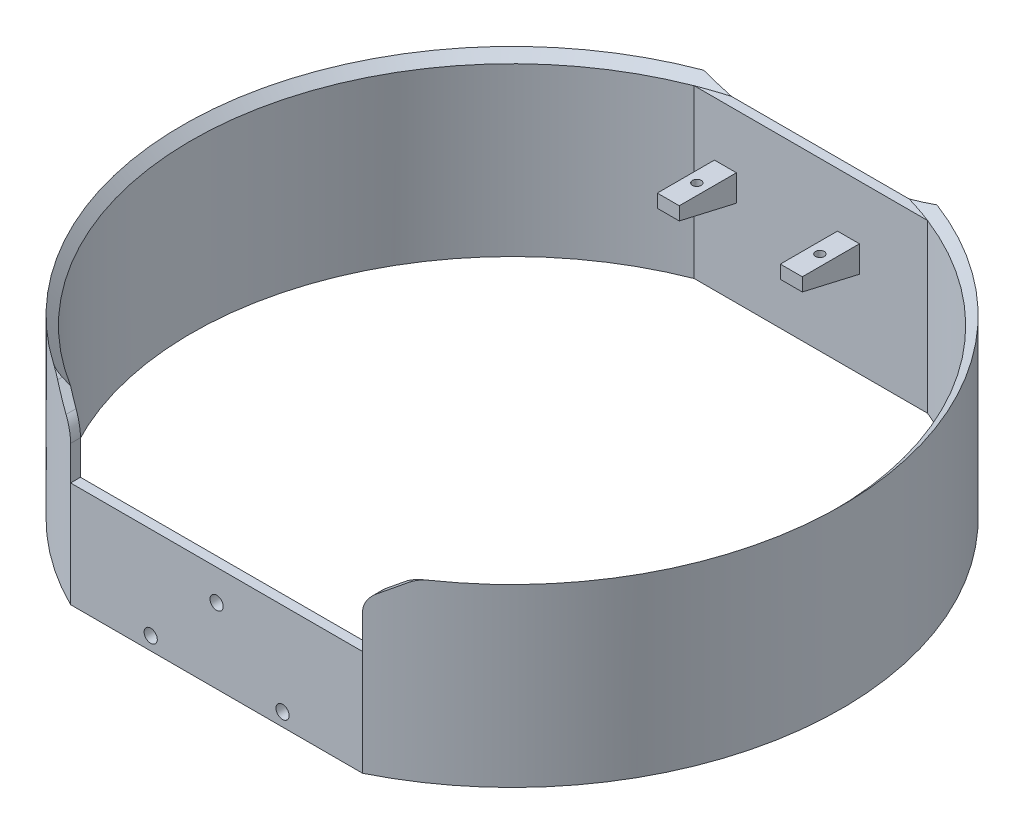
from build123d import *
from OCP.BRepFilletAPI import BRepFilletAPI_MakeChamfer

# Parameters (mm, degrees)
BOSS_EXTRUDE10_DEPTH             = 38
CUT_EXTRUDE7_DEPTH               = 114.357840488
CUT_EXTRUDE7_DEPTH_BACK          = 114.357840488
CUT_EXTRUDE8_REACH               = 164.861
SKETCH44_W                       = 5
SKETCH44_H                       = 3
BOSS_EXTRUDE11_DEPTH             = 13
CHAMFER11_SIZE                   = 3
CHAMFER11_SIZE_2                 = 13
F_2_0_START                      = 25.919230669
F_2_0_2_DIAMETER_HOLE1_OUTLINE_R = 1
F_2_0_2_DIAMETER_HOLE1_DEPTH     = 4.730769331
M4_CLEARANCE_HOLE1_D             = 4.5
F_6_0_6_DIAMETER_HOLE1_D         = 6
FILLET33_R                       = 1
F_3_0_3_DIAMETER_HOLE2_D         = 3
F_3_0_3_DIAMETER_HOLE2_DEPTH     = 2.238381896
SKETCH53_R                       = 75
CUT_EXTRUDE9_DEPTH               = 111.204355799


# Read off the part's stored shape, not the designer's step: Ø2.0 (2) Diameter Hole1
with BuildPart() as part:
    # Sketch34 → Revolve1 (revolve)
    with BuildSketch(Plane.XY, mode=Mode.PRIVATE) as revolve1_sk:
        Polygon((5, 0), (75, 0), (75, 45), (73, 43), (73, 5), (5, 5), align=None)
    revolve(revolve1_sk.sketch.rotate(Axis((0, 0, 0), (0, 1, 0)), 90), axis=Axis((0, 0, 0), (0, 1, 0)))

    # Sketch35 → Boss-Extrude10 (add)
    with BuildSketch(Plane(origin=(0, 5, 0), x_dir=(1, 0, 0), z_dir=(0, 1, 0))):
        with BuildLine():
            Line((-26.551836095, 68), (26.551836095, 68))
            ThreePointArc((26.551836095, 68), (0, 73), (-26.551836095, 68))
        make_face()
        with BuildLine():
            Line((33.226495452, -65), (-33.226495452, -65))
            ThreePointArc((-33.226495452, -65), (0, -73), (33.226495452, -65))
        make_face()
    extrude(amount=BOSS_EXTRUDE10_DEPTH)

    # Sketch36 → Cut-Extrude7 (cut, two sides: drawn at the far end of the back side and taken through both)
    with BuildSketch(Plane(origin=(0, 5, 0), x_dir=(1, 0, 0), z_dir=(0, 1, 0)).offset(-CUT_EXTRUDE7_DEPTH_BACK)):
        with BuildLine():
            Line((-26.551836095, 70.142711667), (26.551836095, 70.142711667))
            ThreePointArc((26.551836095, 70.142711667), (0, 75), (-26.551836095, 70.142711667))
        make_face()
        with BuildLine():
            Line((-33.226495452, -67.238381896), (33.226495452, -67.238381896))
            ThreePointArc((33.226495452, -67.238381896), (0, -75), (-33.226495452, -67.238381896))
        make_face()
    extrude(amount=CUT_EXTRUDE7_DEPTH + CUT_EXTRUDE7_DEPTH_BACK, mode=Mode.SUBTRACT)

    # Sketch43 → Cut-Extrude8 (cut, up to next)
    with BuildSketch(Plane.XY.offset(67.238381896), mode=Mode.PRIVATE) as cut_extrude8_sk1:
        with BuildLine():
            Line((-33.226495452, 29), (33.226495452, 29))
            Line((33.226495452, 29), (33.226495452, 36.795504442))
            ThreePointArc((33.226495452, 36.795504442), (33.791441286, 39.104247508), (35.35861327, 40.891264663))
            Line((35.35861327, 40.891264663), (39.935107214, 44.095760221))
            ThreePointArc((39.935107214, 44.095760221), (41.299460399, 44.768584754), (42.802989396, 45))
            Line((42.802989396, 45), (-42.802989396, 45))
            ThreePointArc((-42.802989396, 45), (-41.299460399, 44.768584754), (-39.935107214, 44.095760221))
            Line((-39.935107214, 44.095760221), (-35.35861327, 40.891264663))
            ThreePointArc((-35.35861327, 40.891264663), (-33.791441286, 39.104247508), (-33.226495452, 36.795504442))
            Line((-33.226495452, 36.795504442), (-33.226495452, 29))
        make_face()
    cut_extrude8_tool1 = extrude(cut_extrude8_sk1.sketch, amount=-CUT_EXTRUDE8_REACH, mode=Mode.PRIVATE) & part.part
    add(cut_extrude8_tool1.solids().sort_by_distance((0, 37.254898, 67.238382))[0], mode=Mode.SUBTRACT)

    # Sketch44 → Boss-Extrude11 (add)
    with BuildSketch(Plane.XY.offset(-68)):
        with Locations((-19.45, 29.15)):
            Rectangle(SKETCH44_W, SKETCH44_H)
        with Locations((8.55, 29.15)):
            Rectangle(SKETCH44_W, SKETCH44_H)
    extrude(amount=BOSS_EXTRUDE11_DEPTH)

    # Chamfer11
    chamfer11_edges_1 = [part.edges().sort_by_distance(p)[0] for p in [
        (8.55, 27.65, -68),
    ]]
    chamfer11_side_1 = [part.faces().sort_by_distance(p)[0] for p in [
        (8.55, 27.59, -68),
    ]]
    chamfer11_edges_2 = [part.edges().sort_by_distance(p)[0] for p in [
        (-19.45, 27.65, -68),
    ]]
    chamfer11_side_2 = [part.faces().sort_by_distance(p)[0] for p in [
        (-19.45, 27.59, -68),
    ]]
    chamfer11 = BRepFilletAPI_MakeChamfer(part.part.solid().wrapped)
    for e in chamfer11_edges_1:
        chamfer11.Add(CHAMFER11_SIZE - 0.0001, CHAMFER11_SIZE_2 - 0.0001, e.wrapped, chamfer11_side_1[0].wrapped)
    for e in chamfer11_edges_2:
        chamfer11.Add(CHAMFER11_SIZE - 0.0001, CHAMFER11_SIZE_2 - 0.0001, e.wrapped, chamfer11_side_2[0].wrapped)
    add(Compound.cast(chamfer11.Shape()), mode=Mode.REPLACE)  # a hair under: the kernel refuses the full size

    # Ø2.0 (2) Diameter Hole1 outline → Ø2.0 (2) Diameter Hole1 (cut)
    with BuildSketch(Plane(origin=(0, 0, 0), x_dir=(1, 0, 0), z_dir=(0, 1, 0)).offset(F_2_0_START)):
        with Locations((8.55, 61.5)):
            Circle(F_2_0_2_DIAMETER_HOLE1_OUTLINE_R)
        with Locations((-19.45, 61.5)):
            Circle(F_2_0_2_DIAMETER_HOLE1_OUTLINE_R)
    extrude(amount=F_2_0_2_DIAMETER_HOLE1_DEPTH, mode=Mode.SUBTRACT)

    # M4 Clearance Hole1 (through all)
    with Locations(Plane(origin=(0, 5, 0), x_dir=(1, 0, 0), z_dir=(0, 1, 0))):
        with Locations((-55, 0), (55, 0), (0, 55), (0, -55)):
            Hole(M4_CLEARANCE_HOLE1_D / 2)

    # Ø6.0 (6) Diameter Hole1 (through all)
    with Locations(Plane(origin=(0, 5, 0), x_dir=(1, 0, 0), z_dir=(0, 1, 0))):
        with Locations((30.0520382, 40.658639918), (40.658639918, 30.0520382), (40.658639918, -30.0520382), (30.0520382, -40.658639918), (-30.0520382, -40.658639918), (-40.658639918, -30.0520382), (-40.658639918, 30.0520382), (-30.0520382, 40.658639918)):
            Hole(F_6_0_6_DIAMETER_HOLE1_D / 2)

    # Fillet33
    fillet33_edges = [part.edges().sort_by_distance(p)[0] for p in [
        (-27.0520382, 5, -40.658639918),
        (-27.0520382, 0, -40.658639918),
        (-37.658639918, 5, -30.0520382),
        (-37.658639918, 0, -30.0520382),
        (-37.658639918, 5, 30.0520382),
        (-37.658639918, 0, 30.0520382),
        (-27.0520382, 5, 40.658639918),
        (-27.0520382, 0, 40.658639918),
        (33.0520382, 5, 40.658639918),
        (33.0520382, 0, 40.658639918),
        (43.658639918, 5, 30.0520382),
        (43.658639918, 0, 30.0520382),
        (43.658639918, 5, -30.0520382),
        (43.658639918, 0, -30.0520382),
        (33.0520382, 5, -40.658639918),
        (33.0520382, 0, -40.658639918),
    ]]
    fillet(fillet33_edges, radius=FILLET33_R)

    # Ø3.0 (3) Diameter Hole2
    with Locations(Plane.XY.offset(67.238381896)):
        with Locations((0, 22), (-15, 8), (15, 8)):
            Hole(F_3_0_3_DIAMETER_HOLE2_D / 2, depth=F_3_0_3_DIAMETER_HOLE2_DEPTH)

    # Sketch53 → Cut-Extrude9 (cut, through all)
    with BuildSketch(Plane(origin=(0, 5, 0), x_dir=(1, 0, 0), z_dir=(0, 1, 0))):
        Circle(SKETCH53_R)
    extrude(amount=-CUT_EXTRUDE9_DEPTH, mode=Mode.SUBTRACT)


solid = part.part
